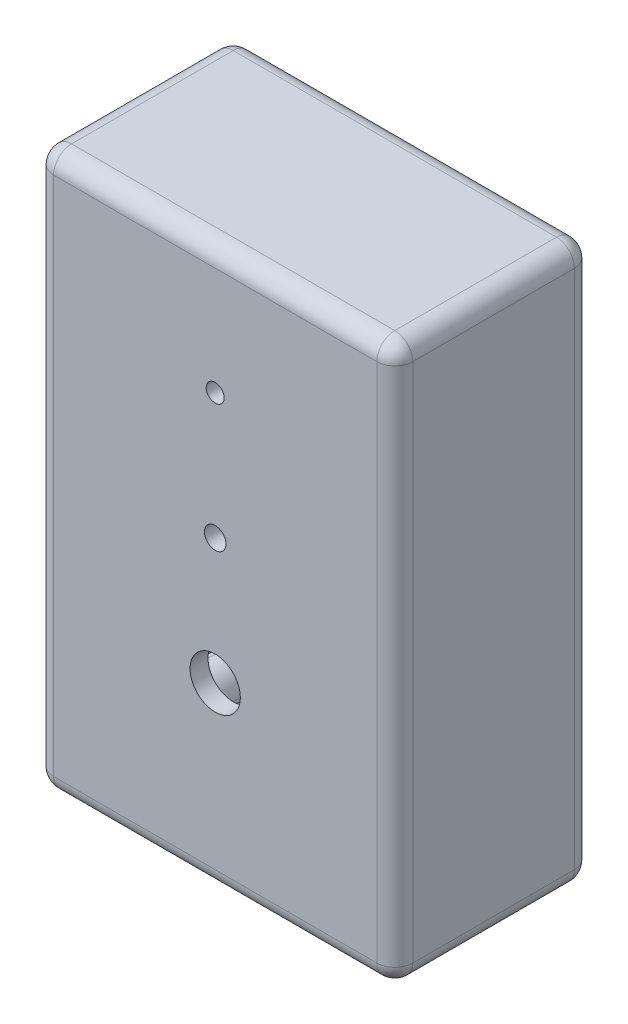
from build123d import *

# Parameters (mm, degrees)
SKETCH6_W           = 100
SKETCH6_H           = 155
BOSS_EXTRUDE5_DEPTH = 55
FILLET2_R           = 5
SHELL3_START        = -45
SHELL3_OUTLINE_W    = 145
SHELL3_OUTLINE_H    = 50
SHELL3_DEPTH        = 90
BOSS_EXTRUDE6_DEPTH = 45
SKETCH8_R           = 2.1
CUT_EXTRUDE1_DEPTH  = 6.5
SKETCH9_R           = 2.5
SKETCH9_R_2         = 3
SKETCH9_R_3         = 7
CUT_EXTRUDE2_DEPTH  = 108.383657975
CUT_EXTRUDE3_REACH  = 173.901
CUT_EXTRUDE4_START  = -3
CUT_EXTRUDE4_DEPTH  = 3
BOSS_EXTRUDE7_DEPTH = 3
SKETCH15_W          = 90.6
SKETCH15_H          = 145.6
CUT_EXTRUDE5_DEPTH  = 5


# Read off the part's stored shape, not the designer's step: Shell3
with BuildPart() as part:
    # Sketch6 → Boss-Extrude5 (new body)
    with BuildSketch(Plane.XY):
        Rectangle(SKETCH6_W, SKETCH6_H)
    extrude(amount=BOSS_EXTRUDE5_DEPTH)

    # Fillet2
    fillet2_edges = [part.edges().sort_by_distance(p)[0] for p in [
        (-50, 0, 55),
        (0, -77.5, 55),
        (50, 0, 55),
        (0, -77.5, 0),
        (-50, 0, 0),
        (0, 77.5, 0),
        (50, 0, 0),
        (50, -77.5, 27.5),
        (-50, -77.5, 27.5),
        (-50, 77.5, 27.5),
        (50, 77.5, 27.5),
        (0, 77.5, 55),
    ]]
    fillet(fillet2_edges, radius=FILLET2_R)

    # Shell3 outline → Shell3 (cut)
    with BuildSketch(Plane.YZ.offset(SHELL3_START)):
        with Locations((0, 25)):
            Rectangle(SHELL3_OUTLINE_W, SHELL3_OUTLINE_H)
    extrude(amount=SHELL3_DEPTH, mode=Mode.SUBTRACT)

    # Sketch7 → Boss-Extrude6 (add)
    with BuildSketch(Plane(origin=(0, 0, 50), x_dir=(-1, 0, 0), z_dir=(0, 0, -1))):
        with BuildLine():
            Line((-45, 72.5), (-37, 72.5))
            Line((-37, 72.5), (-37, 71.5))
            ThreePointArc((-37, 71.5), (-39.050252532, 66.550252532), (-44, 64.5))
            Line((-44, 64.5), (-45, 64.5))
            Line((-45, 64.5), (-45, 72.5))
        make_face()
        with BuildLine():
            Line((45, 72.5), (37, 72.5))
            Line((37, 72.5), (37, 71.5))
            ThreePointArc((37, 71.5), (39.050252532, 66.550252532), (44, 64.5))
            Line((44, 64.5), (45, 64.5))
            Line((45, 64.5), (45, 72.5))
        make_face()
        with BuildLine():
            Line((-45, -64.5), (-44, -64.5))
            ThreePointArc((-44, -64.5), (-39.050252532, -66.550252532), (-37, -71.5))
            Line((-37, -71.5), (-37, -72.5))
            Line((-37, -72.5), (-45, -72.5))
            Line((-45, -72.5), (-45, -64.5))
        make_face()
        with BuildLine():
            Line((45, -72.5), (45, -64.5))
            Line((45, -64.5), (44, -64.5))
            ThreePointArc((44, -64.5), (39.050252532, -66.550252532), (37, -71.5))
            Line((37, -71.5), (37, -72.5))
            Line((37, -72.5), (45, -72.5))
        make_face()
    extrude(amount=BOSS_EXTRUDE6_DEPTH)

    # Sketch8 → Cut-Extrude1 (cut)
    with BuildSketch(Plane(origin=(0, 0, 5), x_dir=(-1, 0, 0), z_dir=(0, 0, -1))):
        with Locations((-42, 69.5)):
            Circle(SKETCH8_R)
        with Locations((42, 69.5)):
            Circle(SKETCH8_R)
        with Locations((42, -69.5)):
            Circle(SKETCH8_R)
        with Locations((-42, -69.5)):
            Circle(SKETCH8_R)
    extrude(amount=-CUT_EXTRUDE1_DEPTH, mode=Mode.SUBTRACT)

    # Sketch9 → Cut-Extrude2 (cut, through all)
    with BuildSketch(Plane.XY.offset(55)):
        with Locations((0, 42.5)):
            Circle(SKETCH9_R)
        with Locations((0, 7.5)):
            Circle(SKETCH9_R_2)
        with Locations((0, -27.5)):
            Circle(SKETCH9_R_3)
    extrude(amount=-CUT_EXTRUDE2_DEPTH, mode=Mode.SUBTRACT)

    # Sketch10 → Cut-Extrude3 (cut, up to next)
    with BuildSketch(Plane.XZ.offset(77.5), mode=Mode.PRIVATE) as cut_extrude3_sk1:
        with BuildLine():
            Line((-3.5, 50), (3.5, 50))
            ThreePointArc((3.5, 50), (4.914213562, 49.414213562), (5.5, 48))
            Line((5.5, 48), (5.5, 47.8))
            ThreePointArc((5.5, 47.8), (4.914213562, 46.385786438), (3.5, 45.8))
            Line((3.5, 45.8), (-3.5, 45.8))
            ThreePointArc((-3.5, 45.8), (-4.914213562, 46.385786438), (-5.5, 47.8))
            Line((-5.5, 47.8), (-5.5, 48))
            ThreePointArc((-5.5, 48), (-4.914213562, 49.414213562), (-3.5, 50))
        make_face()
    cut_extrude3_tool1 = extrude(cut_extrude3_sk1.sketch, amount=-CUT_EXTRUDE3_REACH, mode=Mode.PRIVATE) & part.part
    add(cut_extrude3_tool1.solids().sort_by_distance((0, -77.5, 47.9))[0], mode=Mode.SUBTRACT)

    # Sketch13 → Cut-Extrude4 (cut)
    with BuildSketch(Plane(origin=(0, -72.5, 0), x_dir=(1, 0, 0), z_dir=(0, 1, 0)).offset(CUT_EXTRUDE4_START)):
        with BuildLine():
            Line((5.5, -47.8), (5.5, -48))
            ThreePointArc((5.5, -48), (5.457812626, -48.408619287), (5.333030278, -48.8))
            Line((5.333030278, -48.8), (10.333030278, -48.8))
            Line((10.333030278, -48.8), (10.333030278, -50))
            Line((10.333030278, -50), (3.5, -50))
            Line((3.5, -50), (-3.5, -50))
            Line((-3.5, -50), (-10.333030278, -50))
            Line((-10.333030278, -50), (-10.333030278, -48.8))
            Line((-10.333030278, -48.8), (-5.333030278, -48.8))
            ThreePointArc((-5.333030278, -48.8), (-5.457812626, -48.408619287), (-5.5, -48))
            Line((-5.5, -48), (-5.5, -47.8))
            ThreePointArc((-5.5, -47.8), (-4.914213562, -46.385786438), (-3.5, -45.8))
            Line((-3.5, -45.8), (3.5, -45.8))
            ThreePointArc((3.5, -45.8), (4.914213562, -46.385786438), (5.5, -47.8))
        make_face()
    extrude(amount=CUT_EXTRUDE4_DEPTH, mode=Mode.SUBTRACT)

    # Sketch14 → Boss-Extrude7 (add)
    with BuildSketch(Plane(origin=(0, 0, 50), x_dir=(-1, 0, 0), z_dir=(0, 0, -1))):
        with BuildLine():
            Line((-7.5, -46.6), (7.5, -46.5))
            Line((7.5, -46.5), (7.5, -46.6))
            ThreePointArc((7.5, -46.6), (6.943502884, -47.943502884), (5.6, -48.5))
            Line((5.6, -48.5), (-5.6, -48.5))
            ThreePointArc((-5.6, -48.5), (-6.943502884, -47.943502884), (-7.5, -46.6))
        make_face()
    extrude(amount=BOSS_EXTRUDE7_DEPTH)

    # Sketch15 → Cut-Extrude5 (cut)
    with BuildSketch(Plane(origin=(0, 0, 0), x_dir=(-1, 0, 0), z_dir=(0, 0, -1))):
        Rectangle(SKETCH15_W, SKETCH15_H)
    extrude(amount=-CUT_EXTRUDE5_DEPTH, mode=Mode.SUBTRACT)


solid = part.part
